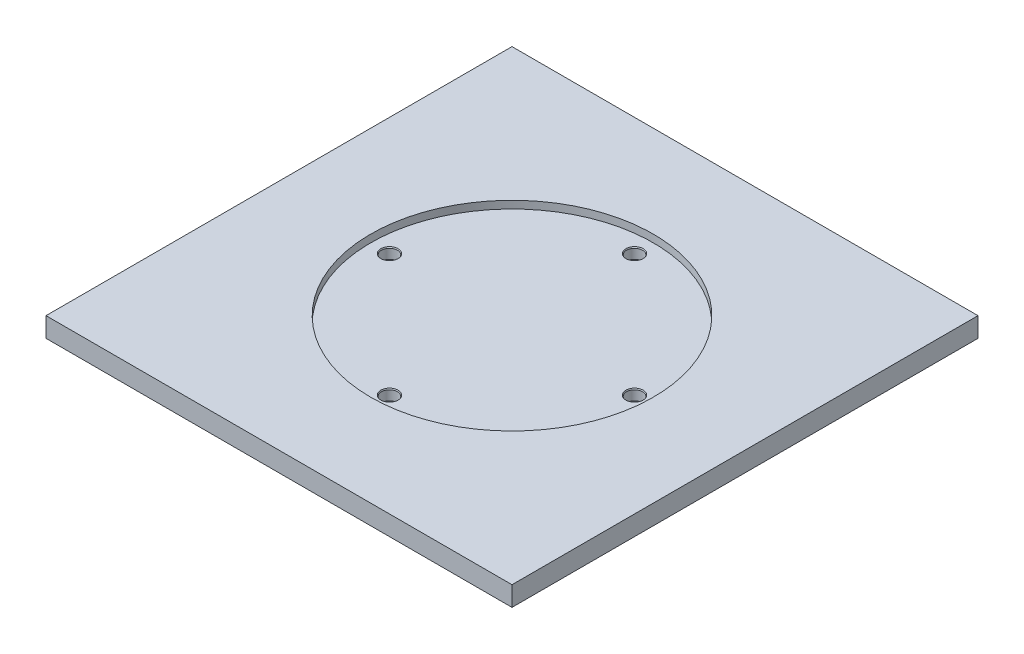
from build123d import *

# Parameters (mm, degrees)
SKETCH1_W           = 154
SKETCH1_H           = 154
BOSS_EXTRUDE1_DEPTH = 6.5
SKETCH2_R           = 46.7
CUT_EXTRUDE1_DEPTH  = 2.5
SKETCH3_R           = 2.65
CUT_EXTRUDE2_DEPTH  = 3.5
CHAMFER1_SIZE       = 0.2
CHAMFER1_SIZE2      = 0.346410162


with BuildPart() as part:
    # Sketch1 → Boss-Extrude1 (new body)
    with BuildSketch(Plane(origin=(0, 0, 0), x_dir=(1, 0, 0), z_dir=(0, 1, 0))):
        Rectangle(SKETCH1_W, SKETCH1_H)
    extrude(amount=BOSS_EXTRUDE1_DEPTH)

    # Sketch2 → Cut-Extrude1 (cut)
    with BuildSketch(Plane(origin=(0, 6.5, 0), x_dir=(1, 0, 0), z_dir=(0, 1, 0))):
        Circle(SKETCH2_R)
    extrude(amount=-CUT_EXTRUDE1_DEPTH, mode=Mode.SUBTRACT)

    # Sketch3 → Cut-Extrude2 (cut)
    with BuildSketch(Plane(origin=(0, 4, 0), x_dir=(1, 0, 0), z_dir=(0, 1, 0))):
        with Locations((0, 40.5)):
            Circle(SKETCH3_R)
        with Locations((-40.5, 0)):
            Circle(SKETCH3_R)
        with Locations((0, -40.5)):
            Circle(SKETCH3_R)
        with Locations((40.5, 0)):
            Circle(SKETCH3_R)
    extrude(amount=-CUT_EXTRUDE2_DEPTH, mode=Mode.SUBTRACT)

    # Chamfer1
    chamfer1_edges = [part.edges().sort_by_distance(p)[0] for p in [
        (-43.15, 4, 0),
        (-2.65, 4, 40.5),
        (-2.65, 4, -40.5),
        (37.85, 4, 0),
    ]]
    chamfer1_side = [part.faces().sort_by_distance(p)[0] for p in [
        (0, 4, 0),
    ]]
    chamfer(chamfer1_edges, length=CHAMFER1_SIZE, length2=CHAMFER1_SIZE2, reference=chamfer1_side[0])


solid = part.part
